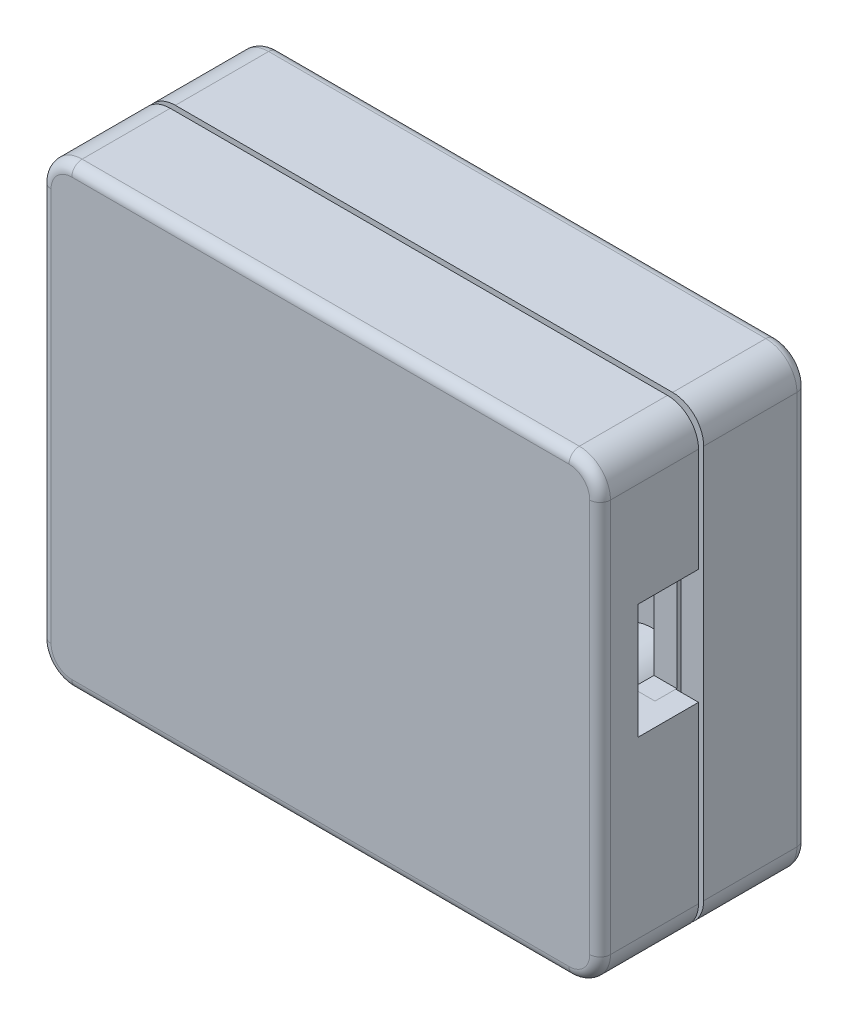
from build123d import *

# Parameters (mm, degrees)
SKETCH1_W                   = 27
SKETCH1_H                   = 22
BOSS_EXTRUDE1_DEPTH         = 5
FILLET1_R                   = 1.5
SHELL1_T                    = 2.2
SKETCH4_W                   = 5.25
SKETCH4_H                   = 13.5
CUT_EXTRUDE1_DEPTH          = 10
SKETCH3_W                   = 2.96
SKETCH3_H                   = 5.56
CUT_EXTRUDE2_DEPTH          = 10
FILLET2_R                   = 0.5
FILLET3_R                   = 0.5
SKETCH5_W                   = 2
SKETCH5_H                   = 1
BOSS_EXTRUDE2_DEPTH         = 2.53
SKETCH5_3_W                 = 2
SKETCH5_3_H                 = 1
BOSS_EXTRUDE3_DEPTH         = 3.48
SKETCH6_W                   = 2
SKETCH6_H                   = 2
BOSS_EXTRUDE4_DEPTH         = 2.12
LIP_GROOVE2_GROOVE_DEPTH    = 1.25
LIP_GROOVE2_GROOVE_2_DEPTH  = 0.25
LIP_GROOVE2_LIP_START       = -9.9
LIP_GROOVE2_LIP_OUTLINE_W   = 24.8
LIP_GROOVE2_LIP_OUTLINE_H   = 1.25
LIP_GROOVE2_LIP_DEPTH       = 1.1
LIP_GROOVE2_LIP_START_2     = 8.8
LIP_GROOVE2_LIP_2_OUTLINE_W = 24.8
LIP_GROOVE2_LIP_2_OUTLINE_H = 1.25
LIP_GROOVE2_LIP_2_DEPTH     = 1.1
LIP_GROOVE2_LIP_START_3     = -8.8
LIP_GROOVE2_LIP_3_OUTLINE_W = 1.1
LIP_GROOVE2_LIP_3_OUTLINE_H = 1.25
LIP_GROOVE2_LIP_3_DEPTH     = 17.6
LIP_GROOVE2_LIP_4_OUTLINE_W = 1.1
LIP_GROOVE2_LIP_4_OUTLINE_H = 1.25
LIP_GROOVE2_LIP_4_DEPTH     = 2.05
LIP_GROOVE2_LIP_START_4     = 6.75
LIP_GROOVE2_LIP_5_OUTLINE_W = 1.1
LIP_GROOVE2_LIP_5_OUTLINE_H = 1.25
LIP_GROOVE2_LIP_5_DEPTH     = 2.05
SKETCH11_W                  = 6
SKETCH11_H                  = 1.25
BOSS_EXTRUDE5_DEPTH         = 5.1
BOSS_EXTRUDE6_DEPTH         = 6
CUT_EXTRUDE3_DEPTH          = 6
FILLET4_R                   = 0.5
SKETCH3_3_W                 = 2.96
SKETCH3_3_H                 = 5.56
CUT_EXTRUDE4_DEPTH          = 10
SKETCH14_R                  = 2.375
SKETCH14_R_2                = 1.375
BOSS_EXTRUDE7_DEPTH         = 2.12


with BuildPart() as part:
    # Sketch1 → Boss-Extrude1 (new, symmetric)
    with BuildSketch(Plane.XY):
        Rectangle(SKETCH1_W, SKETCH1_H)
    extrude(amount=BOSS_EXTRUDE1_DEPTH, both=True)

    # Fillet1
    fillet1_edges = [part.edges().sort_by_distance(p)[0] for p in [
        (-13.5, 11, 0),
        (13.5, 11, 0),
        (13.5, -11, 0),
        (-13.5, -11, 0),
    ]]
    fillet(fillet1_edges, radius=FILLET1_R)

    # Shell1 (no face opened: a closed hollow body)
    add(offset(amount=-SHELL1_T, mode=Mode.PRIVATE), mode=Mode.SUBTRACT)


with BuildPart() as body_2:
    # Split1: the piece on the far side of the plane
    add(part.part)
    split(bisect_by=Plane.XY, keep=Keep.BOTTOM)

    # Mounting Boss1: read off the stored shape, not the designer's step
    # Mounting Boss1 outline → Mounting Boss1 (revolve)
    with BuildSketch(Plane(origin=(8.225, -4.225, 0), x_dir=(1, 0, 0), z_dir=(0, -1, 0))):
        Polygon((2, -0.27), (1.25, -0.27), (1.228181169, 0.98), (0, 0.98), (0, -2.8), (2.088349547, -2.8), align=None)
    revolve(axis=Axis((8.225, -4.225, 0), (0, 0, 1)))


with BuildPart() as part_1:
    add(part.part)

    # Split1
    split(bisect_by=Plane.XY, keep=Keep.TOP)


with BuildPart() as cut_extrude1_tool:
    # Sketch4 → Cut-Extrude1 (new body)
    with BuildSketch(Plane.ZY.offset(13.5)):
        with Locations((0.105, 0)):
            Rectangle(SKETCH4_W, SKETCH4_H)
    extrude(amount=-CUT_EXTRUDE1_DEPTH)


with BuildPart() as part_2:
    add(part_1.part)

    # Cut-Extrude1: cut by cut_extrude1_tool
    add(cut_extrude1_tool.part, mode=Mode.SUBTRACT)

    # Sketch3 → Cut-Extrude2 (cut)
    with BuildSketch(Plane(origin=(13.5, 0, 0), x_dir=(0, 0, -1), z_dir=(1, 0, 0))):
        with Locations((-1.68, 1.7)):
            Rectangle(SKETCH3_W, SKETCH3_H)
    extrude(amount=-CUT_EXTRUDE2_DEPTH, mode=Mode.SUBTRACT)

    # Fillet2
    fillet2_edges = [part_2.edges().sort_by_distance(p)[0] for p in [
        (-13.5, 0, 5),
        (0, 11, 5),
        (0, -11, 5),
        (13.5, 0, 5),
        (-13.060660172, -10.560660172, 5),
        (13.060660172, -10.560660172, 5),
        (13.060660172, 10.560660172, 5),
        (-13.060660172, 10.560660172, 5),
    ]]
    fillet(fillet2_edges, radius=FILLET2_R)

    # Sketch6 → Boss-Extrude4 (add)
    with BuildSketch(Plane(origin=(0, 0, 2.8), x_dir=(-1, 0, 0), z_dir=(0, 0, -1))):
        with Locations((4.5, 7)):
            Rectangle(SKETCH6_W, SKETCH6_H)
    boss_extrude4 = extrude(amount=BOSS_EXTRUDE4_DEPTH)

    # Mirror3: Boss-Extrude4 across plane
    add(boss_extrude4.mirror(Plane.ZX))

    # Lip&Groove2-Groove: read off the stored shape, not the designer's step
    # Lip&Groove2-Groove outline → Lip&Groove2-Groove (cut)
    with BuildSketch(Plane.XY):
        Polygon((-12.4, -9.9), (12.4, -9.9), (12.4, -1.08), (13.5, -1.08), (13.5, 4.48), (12.4, 4.48), (12.4, 9.9), (-12.4, 9.9), (-12.4, 6.75), (-11.3, 6.75), (-11.3, 8.8), (11.3, 8.8), (11.3, -8.8), (-11.3, -8.8), (-11.3, -6.75), (-12.4, -6.75), align=None)
    extrude(amount=LIP_GROOVE2_GROOVE_DEPTH, mode=Mode.SUBTRACT)

    # Lip_Groove2-Groove 2 outline → Lip_Groove2-Groove 2 (cut)
    with BuildSketch(Plane.XY):
        with BuildLine():
            Line((12.4, -1.08), (12.4, -9.9))
            Line((12.4, -9.9), (-12.4, -9.9))
            Line((-12.4, -9.9), (-12.4, -6.75))
            Line((-12.4, -6.75), (-13.5, -6.75))
            Line((-13.5, -6.75), (-13.5, -9.5))
            ThreePointArc((-13.5, -9.5), (-13.060660172, -10.560660172), (-12, -11))
            Line((-12, -11), (12, -11))
            ThreePointArc((12, -11), (13.060660172, -10.560660172), (13.5, -9.5))
            Line((13.5, -9.5), (13.5, -1.08))
            Line((13.5, -1.08), (12.4, -1.08))
        make_face()
        with BuildLine():
            Line((12.4, 4.48), (13.5, 4.48))
            Line((13.5, 4.48), (13.5, 9.5))
            ThreePointArc((13.5, 9.5), (13.060660172, 10.560660172), (12, 11))
            Line((12, 11), (-12, 11))
            ThreePointArc((-12, 11), (-13.060660172, 10.560660172), (-13.5, 9.5))
            Line((-13.5, 9.5), (-13.5, 6.75))
            Line((-13.5, 6.75), (-12.4, 6.75))
            Line((-12.4, 6.75), (-12.4, 9.9))
            Line((-12.4, 9.9), (12.4, 9.9))
            Line((12.4, 9.9), (12.4, 4.48))
        make_face()
    extrude(amount=LIP_GROOVE2_GROOVE_2_DEPTH, mode=Mode.SUBTRACT)

    # Sketch11 → Boss-Extrude5 (add)
    with BuildSketch(Plane(origin=(0, 0, 2.8), x_dir=(-1, 0, 0), z_dir=(0, 0, -1))):
        with Locations((0, -8.175)):
            Rectangle(SKETCH11_W, SKETCH11_H)
    boss_extrude5 = extrude(amount=BOSS_EXTRUDE5_DEPTH)

    # Sketch12 → Boss-Extrude6 (add)
    with BuildSketch(Plane.ZY.offset(3)):
        Polygon((-2.3, -8.8), (-2.05, -9.05), (-1.3, -9.05), (-1.05, -8.8), align=None)
    boss_extrude6 = extrude(amount=-BOSS_EXTRUDE6_DEPTH)

    # Mirror5: Boss-Extrude5, Boss-Extrude6 across plane
    add(boss_extrude5.mirror(Plane.ZX))
    add(boss_extrude6.mirror(Plane.ZX))

    # Sketch14 → Boss-Extrude7 (add)
    with BuildSketch(Plane(origin=(0, 0, 2.8), x_dir=(-1, 0, 0), z_dir=(0, 0, -1))):
        with Locations(Location((-8.225, -4.225, 0), (0, 0, 180))):
            Circle(SKETCH14_R)
        with Locations(Location((-8.225, -4.225, 0), (0, 0, 180))):
            Circle(SKETCH14_R_2, mode=Mode.SUBTRACT)
    extrude(amount=BOSS_EXTRUDE7_DEPTH)


with BuildPart() as body_2_1:
    add(body_2.part)

    # Cut-Extrude1: cut by cut_extrude1_tool
    add(cut_extrude1_tool.part, mode=Mode.SUBTRACT)

    # Fillet3
    fillet3_edges = [body_2_1.edges().sort_by_distance(p)[0] for p in [
        (-13.5, 0, -5),
        (0, -11, -5),
        (13.5, 0, -5),
        (0, 11, -5),
        (-13.060660172, -10.560660172, -5),
        (13.060660172, -10.560660172, -5),
        (13.060660172, 10.560660172, -5),
        (-13.060660172, 10.560660172, -5),
    ]]
    fillet(fillet3_edges, radius=FILLET3_R)

    # Sketch5 → Boss-Extrude2 (add)
    with BuildSketch(Plane.XY.offset(-2.8)):
        with Locations((-4.5, 7.5)):
            Rectangle(SKETCH5_W, SKETCH5_H)
        with Locations((-4.5, 6.5)):
            Rectangle(SKETCH5_W, SKETCH5_H)
    boss_extrude2 = extrude(amount=BOSS_EXTRUDE2_DEPTH)

    # Sketch5<3> → Boss-Extrude3 (add)
    with BuildSketch(Plane.XY.offset(-2.8)):
        with Locations((-4.5, 7.5)):
            Rectangle(SKETCH5_3_W, SKETCH5_3_H)
    boss_extrude3 = extrude(amount=BOSS_EXTRUDE3_DEPTH)

    # Mirror2: Boss-Extrude2, Boss-Extrude3 across plane
    add(boss_extrude2.mirror(Plane.ZX))
    add(boss_extrude3.mirror(Plane.ZX))

    # Lip&Groove2-Lip: read off the stored shape, not the designer's step
    # Lip&Groove2-Lip outline → Lip&Groove2-Lip (add)
    with BuildSketch(Plane(origin=(0, 0, 0), x_dir=(1, 0, 0), z_dir=(0, 1, 0)).offset(LIP_GROOVE2_LIP_START)):
        with Locations((0, -0.625)):
            Rectangle(LIP_GROOVE2_LIP_OUTLINE_W, LIP_GROOVE2_LIP_OUTLINE_H)
    extrude(amount=LIP_GROOVE2_LIP_DEPTH)

    # Lip_Groove2-Lip 2 outline → Lip_Groove2-Lip 2 (add)
    with BuildSketch(Plane(origin=(0, 0, 0), x_dir=(1, 0, 0), z_dir=(0, 1, 0)).offset(LIP_GROOVE2_LIP_START_2)):
        with Locations((0, -0.625)):
            Rectangle(LIP_GROOVE2_LIP_2_OUTLINE_W, LIP_GROOVE2_LIP_2_OUTLINE_H)
    extrude(amount=LIP_GROOVE2_LIP_2_DEPTH)

    # Lip_Groove2-Lip 3 outline → Lip_Groove2-Lip 3 (add)
    with BuildSketch(Plane(origin=(0, 0, 0), x_dir=(1, 0, 0), z_dir=(0, 1, 0)).offset(LIP_GROOVE2_LIP_START_3)):
        with Locations((11.85, -0.625)):
            Rectangle(LIP_GROOVE2_LIP_3_OUTLINE_W, LIP_GROOVE2_LIP_3_OUTLINE_H)
    extrude(amount=LIP_GROOVE2_LIP_3_DEPTH)

    # Lip_Groove2-Lip 4 outline → Lip_Groove2-Lip 4 (add)
    with BuildSketch(Plane(origin=(0, 0, 0), x_dir=(1, 0, 0), z_dir=(0, 1, 0)).offset(LIP_GROOVE2_LIP_START_3)):
        with Locations((-11.85, -0.625)):
            Rectangle(LIP_GROOVE2_LIP_4_OUTLINE_W, LIP_GROOVE2_LIP_4_OUTLINE_H)
    extrude(amount=LIP_GROOVE2_LIP_4_DEPTH)

    # Lip_Groove2-Lip 5 outline → Lip_Groove2-Lip 5 (add)
    with BuildSketch(Plane(origin=(0, 0, 0), x_dir=(1, 0, 0), z_dir=(0, 1, 0)).offset(LIP_GROOVE2_LIP_START_4)):
        with Locations((-11.85, -0.625)):
            Rectangle(LIP_GROOVE2_LIP_5_OUTLINE_W, LIP_GROOVE2_LIP_5_OUTLINE_H)
    extrude(amount=LIP_GROOVE2_LIP_5_DEPTH)

    # Sketch12<2> → Cut-Extrude3 (cut)
    with BuildSketch(Plane.ZY.offset(3)):
        Polygon((-2.3, -8.8), (-2.05, -9.05), (-1.3, -9.05), (-1.05, -8.8), align=None)
    cut_extrude3 = extrude(amount=-CUT_EXTRUDE3_DEPTH, mode=Mode.SUBTRACT)

    # Mirror6: Cut-Extrude3 across plane
    add(cut_extrude3.mirror(Plane.ZX), mode=Mode.SUBTRACT)

    # Fillet4
    fillet4_edges = [body_2_1.edges().sort_by_distance(p)[0] for p in [
        (-12.4, -9.9, 0.625),
        (12.4, -9.9, 0.625),
        (12.4, 9.9, 0.625),
        (-12.4, 9.9, 0.625),
    ]]
    fillet(fillet4_edges, radius=FILLET4_R)

    # Sketch3<3> → Cut-Extrude4 (cut)
    with BuildSketch(Plane(origin=(13.5, 0, 0), x_dir=(0, 0, -1), z_dir=(1, 0, 0))):
        with Locations((-1.68, 1.7)):
            Rectangle(SKETCH3_3_W, SKETCH3_3_H)
    extrude(amount=-CUT_EXTRUDE4_DEPTH, mode=Mode.SUBTRACT)


solid = Compound([part_2.part, body_2_1.part])
